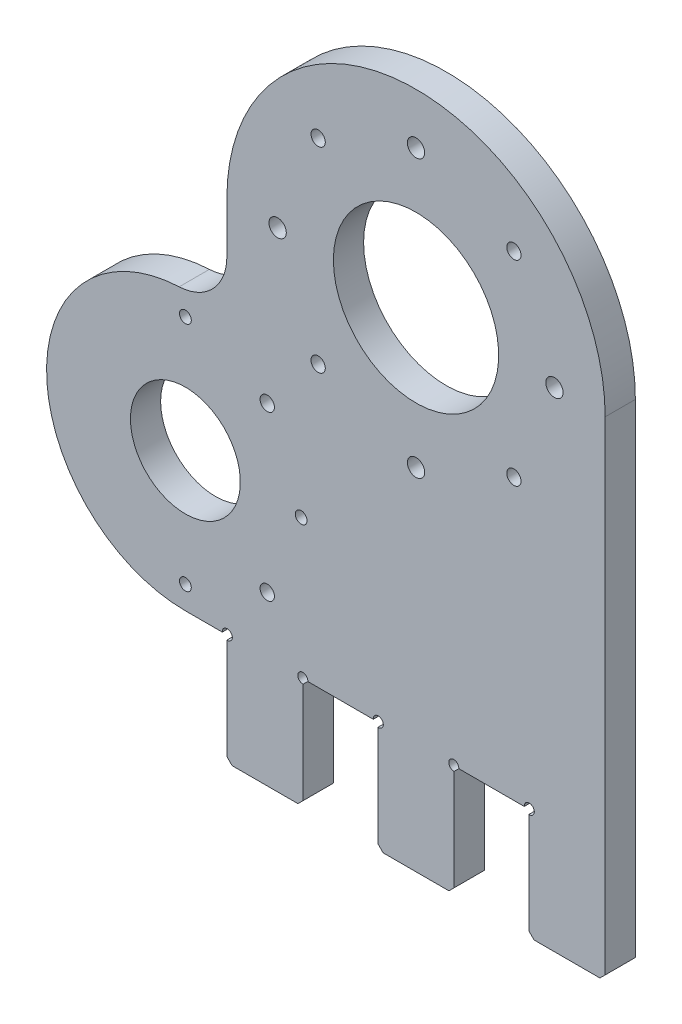
from build123d import *

# Parameters (mm, degrees)
SKETCH1_R               = 11
SKETCH1_R_2             = 16.5
SKETCH1_R_3             = 1.25
SKETCH1_R_4             = 1.5
SKETCH1_R_5             = 1.8
BOSS_EXTRUDE1_DEPTH     = 6
FILLET1_R               = 10
SKETCH2_W               = 15
SKETCH2_H               = 22
BOSS_EXTRUDE2_DEPTH     = 6
CHAMFER1_SIZE           = 1
SKETCH3_R               = 1
CUT_EXTRUDE1_DEPTH      = 159.031622895
MOVE_FACE1_OUTLINE_R    = 11
MOVE_FACE1_OUTLINE_R_2  = 10.92
MOVE_FACE1_OUTLINE_R_3  = 16.5
MOVE_FACE1_OUTLINE_R_4  = 16.42
MOVE_FACE1_OUTLINE_R_5  = 1.25
MOVE_FACE1_OUTLINE_R_6  = 1.17
MOVE_FACE1_OUTLINE_R_7  = 1.5
MOVE_FACE1_OUTLINE_R_8  = 1.42
MOVE_FACE1_OUTLINE_R_9  = 1.8
MOVE_FACE1_OUTLINE_R_10 = 1.72
MOVE_FACE1_DEPTH        = 6


# Read off the part's stored shape, not the designer's step: Move Face1
with BuildPart() as part:
    # Sketch1 → Boss-Extrude1 (new body)
    with BuildSketch(Plane.XY):
        with BuildLine():
            Line((-40.498784978, 0), (0, 0))
            Line((0, 0), (0, 75))
            ThreePointArc((0, 75), (-37.5, 112.5), (-75, 75))
            Line((-75, 75), (-75, 55))
            Line((-75, 55), (-83.323029145, 55))
            ThreePointArc((-83.323029145, 55), (-110.823029145, 27.5), (-83.323029145, 0))
            Line((-83.323029145, 0), (-40.498784978, 0))
        make_face()
        with Locations((-83.323029145, 27.5)):
            Circle(SKETCH1_R, mode=Mode.SUBTRACT)
        with Locations((-37.5, 75)):
            Circle(SKETCH1_R_2, mode=Mode.SUBTRACT)
        with Locations((-83.323029145, 50.5)):
            Circle(SKETCH1_R_3, mode=Mode.SUBTRACT)
        with Locations((-67.059573177, 43.763455967)):
            Circle(SKETCH1_R_4, mode=Mode.SUBTRACT)
        with Locations((-60.323029145, 27.5)):
            Circle(SKETCH1_R_3, mode=Mode.SUBTRACT)
        with Locations((-67.059573177, 11.236544033)):
            Circle(SKETCH1_R_4, mode=Mode.SUBTRACT)
        with Locations((-83.323029145, 4.5)):
            Circle(SKETCH1_R_3, mode=Mode.SUBTRACT)
        with Locations((-37.5, 102.5)):
            Circle(SKETCH1_R_5, mode=Mode.SUBTRACT)
        with Locations((-10, 75)):
            Circle(SKETCH1_R_5, mode=Mode.SUBTRACT)
        with Locations((-37.5, 47.5)):
            Circle(SKETCH1_R_5, mode=Mode.SUBTRACT)
        with Locations((-65, 75)):
            Circle(SKETCH1_R_5, mode=Mode.SUBTRACT)
        with Locations((-18.054563517, 94.445436483)):
            Circle(SKETCH1_R_4, mode=Mode.SUBTRACT)
        with Locations((-18.054563517, 55.554563517)):
            Circle(SKETCH1_R_4, mode=Mode.SUBTRACT)
        with Locations((-56.945436483, 55.554563517)):
            Circle(SKETCH1_R_4, mode=Mode.SUBTRACT)
        with Locations((-56.945436483, 94.445436483)):
            Circle(SKETCH1_R_4, mode=Mode.SUBTRACT)
    extrude(amount=BOSS_EXTRUDE1_DEPTH)

    # Fillet1
    fillet1_edges = [part.edges().sort_by_distance(p)[0] for p in [
        (-75, 55, 3),
    ]]
    fillet(fillet1_edges, radius=FILLET1_R)

    # Sketch2 → Boss-Extrude2 (add)
    with BuildSketch(Plane(origin=(0, 0, 0), x_dir=(-1, 0, 0), z_dir=(0, 0, -1))):
        with Locations((7.5, -11)):
            Rectangle(SKETCH2_W, SKETCH2_H)
        with Locations((37.5, -11)):
            Rectangle(SKETCH2_W, SKETCH2_H)
        with Locations((67.5, -11)):
            Rectangle(SKETCH2_W, SKETCH2_H)
    extrude(amount=-BOSS_EXTRUDE2_DEPTH)

    # Chamfer1
    chamfer1_edges = [part.edges().sort_by_distance(p)[0] for p in [
        (-30, -22, 3),
        (-45, -22, 3),
        (-60, -22, 3),
        (-75, -22, 3),
        (0, -22, 3),
        (-15, -22, 3),
    ]]
    chamfer(chamfer1_edges, length=CHAMFER1_SIZE)

    # Sketch3 → Cut-Extrude1 (cut, through all)
    with BuildSketch(Plane.XY.offset(6)):
        with Locations((-75, 0)):
            Circle(SKETCH3_R)
        with Locations((-60, 0)):
            Circle(SKETCH3_R)
        with Locations((-45, 0)):
            Circle(SKETCH3_R)
        with Locations((-30, 0)):
            Circle(SKETCH3_R)
        with Locations((-15, 0)):
            Circle(SKETCH3_R)
    extrude(amount=-CUT_EXTRUDE1_DEPTH, mode=Mode.SUBTRACT)

    # Move Face1 outline → Move Face1 (add)
    # profile 1 of 20: a face of its own
    with BuildSketch(Plane.XY):
        with BuildLine():
            Line((-59.003205136, -0.08), (-45.996794864, -0.08))
            ThreePointArc((-45.996794864, -0.08), (-45.999198395, -0.04003209), (-46, 0))
            Line((-46, 0), (-59, 0))
            ThreePointArc((-59, 0), (-59.000801605, -0.04003209), (-59.003205136, -0.08))
        make_face()
    # profile 2 of 20: a face of its own
    with BuildSketch(Plane.XY):
        with BuildLine():
            Line((-45, -21), (-45, -1))
            ThreePointArc((-45, -1), (-45.04003209, -0.999198395), (-45.08, -0.996794864))
            Line((-45.08, -0.996794864), (-45.08, -21.033137085))
            Line((-45.08, -21.033137085), (-44.033137085, -22.08))
            Line((-44.033137085, -22.08), (-30.966862915, -22.08))
            Line((-30.966862915, -22.08), (-29.92, -21.033137085))
            Line((-29.92, -21.033137085), (-29.92, -0.996794864))
            ThreePointArc((-29.92, -0.996794864), (-29.95996791, -0.999198395), (-30, -1))
            Line((-30, -1), (-30, -21))
            Line((-30, -21), (-31, -22))
            Line((-31, -22), (-44, -22))
            Line((-44, -22), (-45, -21))
        make_face()
    # profile 3 of 20: a face of its own
    with BuildSketch(Plane.XY):
        with BuildLine():
            ThreePointArc((-59.92, -0.996794864), (-59.95996791, -0.999198395), (-60, -1))
            Line((-60, -1), (-60, -21))
            Line((-60, -21), (-61, -22))
            Line((-61, -22), (-74, -22))
            Line((-74, -22), (-75, -21))
            Line((-75, -21), (-75, -1))
            ThreePointArc((-75, -1), (-75.04003209, -0.999198395), (-75.08, -0.996794864))
            Line((-75.08, -0.996794864), (-75.08, -21.033137085))
            Line((-75.08, -21.033137085), (-74.033137085, -22.08))
            Line((-74.033137085, -22.08), (-60.966862915, -22.08))
            Line((-60.966862915, -22.08), (-59.92, -21.033137085))
            Line((-59.92, -21.033137085), (-59.92, -0.996794864))
        make_face()
    # profile 4 of 20: a face of its own
    with BuildSketch(Plane.XY):
        with BuildLine():
            Line((-16, 0), (-29, 0))
            ThreePointArc((-29, 0), (-29.000801605, -0.04003209), (-29.003205136, -0.08))
            Line((-29.003205136, -0.08), (-15.996794864, -0.08))
            ThreePointArc((-15.996794864, -0.08), (-15.999198395, -0.04003209), (-16, 0))
        make_face()
    # profile 5 of 20: a face of its own
    with BuildSketch(Plane.XY):
        with BuildLine():
            ThreePointArc((-75.996794864, -0.08), (-75.999198395, -0.04003209), (-76, 0))
            Line((-76, 0), (-83.323029145, 0))
            ThreePointArc((-83.323029145, 0), (-110.816150501, 26.884956844), (-84.552807772, 54.972488867))
            ThreePointArc((-84.552807772, 54.972488867), (-77.772555006, 58.051331596), (-75, 64.962484818))
            Line((-75, 64.962484818), (-75, 75))
            ThreePointArc((-75, 75), (-37.5, 112.5), (0, 75))
            Line((0, 75), (0, -21))
            Line((0, -21), (-1, -22))
            Line((-1, -22), (-14, -22))
            Line((-14, -22), (-15, -21))
            Line((-15, -21), (-15, -1))
            ThreePointArc((-15, -1), (-15.04003209, -0.999198395), (-15.08, -0.996794864))
            Line((-15.08, -0.996794864), (-15.08, -21.033137085))
            Line((-15.08, -21.033137085), (-14.033137085, -22.08))
            Line((-14.033137085, -22.08), (-0.966862915, -22.08))
            Line((-0.966862915, -22.08), (0.08, -21.033137085))
            Line((0.08, -21.033137085), (0.08, 75))
            ThreePointArc((0.08, 75), (-37.5, 112.58), (-75.08, 75))
            Line((-75.08, 75), (-75.08, 64.962484818))
            ThreePointArc((-75.08, 64.962484818), (-77.830374566, 58.106620822), (-84.55638531, 55.052408834))
            ThreePointArc((-84.55638531, 55.052408834), (-110.896130491, 26.883167628), (-83.323029145, -0.08))
            Line((-83.323029145, -0.08), (-75.996794864, -0.08))
        make_face()
    # profile 6 of 20: a face of its own
    with BuildSketch(Plane.XY):
        with Locations((-83.323029145, 27.5)):
            Circle(MOVE_FACE1_OUTLINE_R)
        with Locations((-83.323029145, 27.5)):
            Circle(MOVE_FACE1_OUTLINE_R_2, mode=Mode.SUBTRACT)
    # profile 7 of 20: a face of its own
    with BuildSketch(Plane.XY):
        with Locations((-37.5, 75)):
            Circle(MOVE_FACE1_OUTLINE_R_3)
        with Locations((-37.5, 75)):
            Circle(MOVE_FACE1_OUTLINE_R_4, mode=Mode.SUBTRACT)
    # profile 8 of 20: a face of its own
    with BuildSketch(Plane.XY):
        with Locations((-83.323029145, 50.5)):
            Circle(MOVE_FACE1_OUTLINE_R_5)
        with Locations((-83.323029145, 50.5)):
            Circle(MOVE_FACE1_OUTLINE_R_6, mode=Mode.SUBTRACT)
    # profile 9 of 20: a face of its own
    with BuildSketch(Plane.XY):
        with Locations((-67.059573177, 43.763455967)):
            Circle(MOVE_FACE1_OUTLINE_R_7)
        with Locations((-67.059573177, 43.763455967)):
            Circle(MOVE_FACE1_OUTLINE_R_8, mode=Mode.SUBTRACT)
    # profile 10 of 20: a face of its own
    with BuildSketch(Plane.XY):
        with Locations((-37.5, 102.5)):
            Circle(MOVE_FACE1_OUTLINE_R_9)
        with Locations((-37.5, 102.5)):
            Circle(MOVE_FACE1_OUTLINE_R_10, mode=Mode.SUBTRACT)
    # profile 11 of 20: a face of its own
    with BuildSketch(Plane.XY):
        with Locations((-60.323029145, 27.5)):
            Circle(MOVE_FACE1_OUTLINE_R_5)
        with Locations((-60.323029145, 27.5)):
            Circle(MOVE_FACE1_OUTLINE_R_6, mode=Mode.SUBTRACT)
    # profile 12 of 20: a face of its own
    with BuildSketch(Plane.XY):
        with Locations((-67.059573177, 11.236544033)):
            Circle(MOVE_FACE1_OUTLINE_R_7)
        with Locations((-67.059573177, 11.236544033)):
            Circle(MOVE_FACE1_OUTLINE_R_8, mode=Mode.SUBTRACT)
    # profile 13 of 20: a face of its own
    with BuildSketch(Plane.XY):
        with Locations((-83.323029145, 4.5)):
            Circle(MOVE_FACE1_OUTLINE_R_5)
        with Locations((-83.323029145, 4.5)):
            Circle(MOVE_FACE1_OUTLINE_R_6, mode=Mode.SUBTRACT)
    # profile 14 of 20: a face of its own
    with BuildSketch(Plane.XY):
        with Locations((-10, 75)):
            Circle(MOVE_FACE1_OUTLINE_R_9)
        with Locations((-10, 75)):
            Circle(MOVE_FACE1_OUTLINE_R_10, mode=Mode.SUBTRACT)
    # profile 15 of 20: a face of its own
    with BuildSketch(Plane.XY):
        with Locations((-37.5, 47.5)):
            Circle(MOVE_FACE1_OUTLINE_R_9)
        with Locations((-37.5, 47.5)):
            Circle(MOVE_FACE1_OUTLINE_R_10, mode=Mode.SUBTRACT)
    # profile 16 of 20: a face of its own
    with BuildSketch(Plane.XY):
        with Locations((-65, 75)):
            Circle(MOVE_FACE1_OUTLINE_R_9)
        with Locations((-65, 75)):
            Circle(MOVE_FACE1_OUTLINE_R_10, mode=Mode.SUBTRACT)
    # profile 17 of 20: a face of its own
    with BuildSketch(Plane.XY):
        with Locations((-18.054563517, 94.445436483)):
            Circle(MOVE_FACE1_OUTLINE_R_7)
        with Locations((-18.054563517, 94.445436483)):
            Circle(MOVE_FACE1_OUTLINE_R_8, mode=Mode.SUBTRACT)
    # profile 18 of 20: a face of its own
    with BuildSketch(Plane.XY):
        with Locations((-18.054563517, 55.554563517)):
            Circle(MOVE_FACE1_OUTLINE_R_7)
        with Locations((-18.054563517, 55.554563517)):
            Circle(MOVE_FACE1_OUTLINE_R_8, mode=Mode.SUBTRACT)
    # profile 19 of 20: a face of its own
    with BuildSketch(Plane.XY):
        with Locations((-56.945436483, 55.554563517)):
            Circle(MOVE_FACE1_OUTLINE_R_7)
        with Locations((-56.945436483, 55.554563517)):
            Circle(MOVE_FACE1_OUTLINE_R_8, mode=Mode.SUBTRACT)
    # profile 20 of 20: a face of its own
    with BuildSketch(Plane.XY):
        with Locations((-56.945436483, 94.445436483)):
            Circle(MOVE_FACE1_OUTLINE_R_7)
        with Locations((-56.945436483, 94.445436483)):
            Circle(MOVE_FACE1_OUTLINE_R_8, mode=Mode.SUBTRACT)
    extrude(amount=MOVE_FACE1_DEPTH)


solid = part.part
